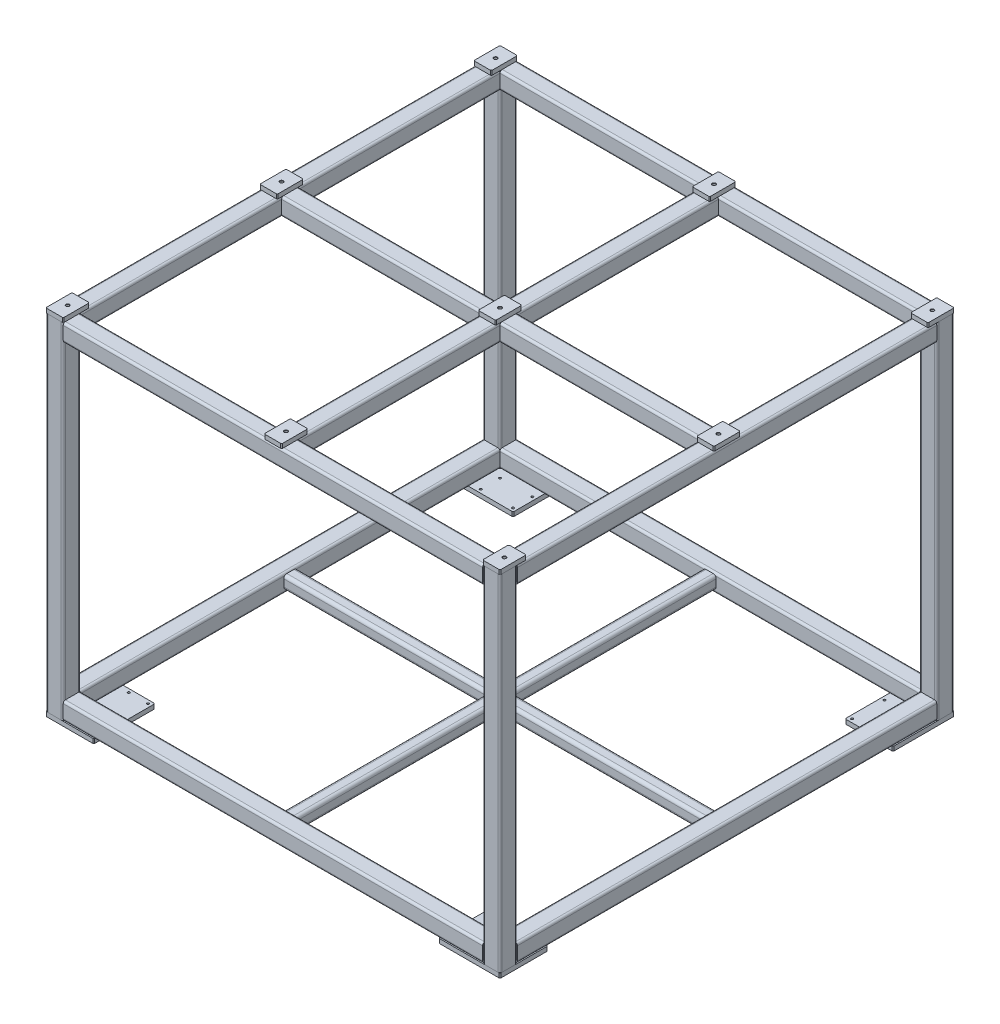
from build123d import *

# Parameters (mm, degrees)
F_40_START                  = -480
F_40_X_40_X_2_5_1_DEPTH     = 960
F_40_X_40_X_2_5_1_2_DEPTH   = 960
F_40_X_40_X_2_5_1_3_DEPTH   = 460
F_40_START_2                = 20
F_40_X_40_X_2_5_1_4_DEPTH   = 460
F_40_START_3                = -750
F_40_X_40_X_2_5_1_5_DEPTH   = 750
F_30_X_30_X_3_5_1_DEPTH     = 1000
F_30_X_30_X_3_5_1_2_DEPTH   = 501
F_30_X_30_X_3_5_1_3_DEPTH   = 501
WELD_START                  = -770
WELD_TRIM_1_DEPTH           = 790
SKETCH_4_W                  = 40
SKETCH_4_H                  = 60
EXTRUDE_1_DEPTH             = 10
CHAMFER_1_SIZE              = 2
PATTERN_LINEAR_1_COUNT      = 3
PATTERN_LINEAR_1_PITCH      = 500
PATTERN_LINEAR_1_2_COUNT    = 3
PATTERN_LINEAR_1_2_PITCH    = 490
SKETCH_7_W                  = 110
SKETCH_7_H                  = 140
EXTRUDE_2_DEPTH             = 10
CHAMFER_2_SIZE              = 2
HOLE_WIZARD_M6_2_AT_2_COUNT = 2
HOLE_WIZARD_M6_2_AT_2_PITCH = 44
HOLE_WIZARD_M6_2_AT_3_COUNT = 2
HOLE_WIZARD_M6_2_AT_3_PITCH = 74
HOLE_WIZARD_M6_2_AT_4_COUNT = 2
HOLE_WIZARD_M6_2_AT_4_PITCH = 86.092973
PATTERN_CIRCULAR_1_COUNT    = 4


# Read off the part's stored shape, not the designer's step: 方管 40 X 40 X 2.5(1), 剪裁/延伸1
with BuildPart() as part:
    # 方管 40 X 40 X 2.5(1) outline → 方管 40 X 40 X 2.5(1) (new body)
    # profile 1 of 5: a face of its own
    with BuildSketch(Plane.XY.offset(F_40_START)):
        with BuildLine():
            Line((520, -15), (520, 15))
            ThreePointArc((520, 15), (518.535533906, 18.535533906), (515, 20))
            Line((515, 20), (485, 20))
            ThreePointArc((485, 20), (481.464466094, 18.535533906), (480, 15))
            Line((480, 15), (480, -15))
            ThreePointArc((480, -15), (481.464466094, -18.535533906), (485, -20))
            Line((485, -20), (515, -20))
            ThreePointArc((515, -20), (518.535533906, -18.535533906), (520, -15))
        make_face()
        with BuildLine():
            ThreePointArc((485, -17.5), (483.232233047, -16.767766953), (482.5, -15))
            Line((482.5, -15), (482.5, 15))
            ThreePointArc((482.5, 15), (483.232233047, 16.767766953), (485, 17.5))
            Line((485, 17.5), (515, 17.5))
            ThreePointArc((515, 17.5), (516.767766953, 16.767766953), (517.5, 15))
            Line((517.5, 15), (517.5, -15))
            ThreePointArc((517.5, -15), (516.767766953, -16.767766953), (515, -17.5))
            Line((515, -17.5), (485, -17.5))
        make_face(mode=Mode.SUBTRACT)
    # profile 2 of 5: a face of its own
    with BuildSketch(Plane.XY.offset(F_40_START)):
        with BuildLine():
            Line((520, -765), (520, -735))
            ThreePointArc((520, -735), (518.535533906, -731.464466094), (515, -730))
            Line((515, -730), (485, -730))
            ThreePointArc((485, -730), (481.464466094, -731.464466094), (480, -735))
            Line((480, -735), (480, -765))
            ThreePointArc((480, -765), (481.464466094, -768.535533906), (485, -770))
            Line((485, -770), (515, -770))
            ThreePointArc((515, -770), (518.535533906, -768.535533906), (520, -765))
        make_face()
        with BuildLine():
            ThreePointArc((485, -767.5), (483.232233047, -766.767766953), (482.5, -765))
            Line((482.5, -765), (482.5, -735))
            ThreePointArc((482.5, -735), (483.232233047, -733.232233047), (485, -732.5))
            Line((485, -732.5), (515, -732.5))
            ThreePointArc((515, -732.5), (516.767766953, -733.232233047), (517.5, -735))
            Line((517.5, -735), (517.5, -765))
            ThreePointArc((517.5, -765), (516.767766953, -766.767766953), (515, -767.5))
            Line((515, -767.5), (485, -767.5))
        make_face(mode=Mode.SUBTRACT)
    # profile 3 of 5: a face of its own
    with BuildSketch(Plane.XY.offset(F_40_START)):
        with BuildLine():
            Line((-480, -15), (-480, 15))
            ThreePointArc((-480, 15), (-481.464466094, 18.535533906), (-485, 20))
            Line((-485, 20), (-515, 20))
            ThreePointArc((-515, 20), (-518.535533906, 18.535533906), (-520, 15))
            Line((-520, 15), (-520, -15))
            ThreePointArc((-520, -15), (-518.535533906, -18.535533906), (-515, -20))
            Line((-515, -20), (-485, -20))
            ThreePointArc((-485, -20), (-481.464466094, -18.535533906), (-480, -15))
        make_face()
        with BuildLine():
            ThreePointArc((-515, -17.5), (-516.767766953, -16.767766953), (-517.5, -15))
            Line((-517.5, -15), (-517.5, 15))
            ThreePointArc((-517.5, 15), (-516.767766953, 16.767766953), (-515, 17.5))
            Line((-515, 17.5), (-485, 17.5))
            ThreePointArc((-485, 17.5), (-483.232233047, 16.767766953), (-482.5, 15))
            Line((-482.5, 15), (-482.5, -15))
            ThreePointArc((-482.5, -15), (-483.232233047, -16.767766953), (-485, -17.5))
            Line((-485, -17.5), (-515, -17.5))
        make_face(mode=Mode.SUBTRACT)
    # profile 4 of 5: a face of its own
    with BuildSketch(Plane.XY.offset(F_40_START)):
        with BuildLine():
            Line((-480, -765), (-480, -735))
            ThreePointArc((-480, -735), (-481.464466094, -731.464466094), (-485, -730))
            Line((-485, -730), (-515, -730))
            ThreePointArc((-515, -730), (-518.535533906, -731.464466094), (-520, -735))
            Line((-520, -735), (-520, -765))
            ThreePointArc((-520, -765), (-518.535533906, -768.535533906), (-515, -770))
            Line((-515, -770), (-485, -770))
            ThreePointArc((-485, -770), (-481.464466094, -768.535533906), (-480, -765))
        make_face()
        with BuildLine():
            ThreePointArc((-515, -767.5), (-516.767766953, -766.767766953), (-517.5, -765))
            Line((-517.5, -765), (-517.5, -735))
            ThreePointArc((-517.5, -735), (-516.767766953, -733.232233047), (-515, -732.5))
            Line((-515, -732.5), (-485, -732.5))
            ThreePointArc((-485, -732.5), (-483.232233047, -733.232233047), (-482.5, -735))
            Line((-482.5, -735), (-482.5, -765))
            ThreePointArc((-482.5, -765), (-483.232233047, -766.767766953), (-485, -767.5))
            Line((-485, -767.5), (-515, -767.5))
        make_face(mode=Mode.SUBTRACT)
    # profile 5 of 5: a face of its own
    with BuildSketch(Plane.XY.offset(F_40_START)):
        with BuildLine():
            Line((20, -15), (20, 15))
            ThreePointArc((20, 15), (18.535533906, 18.535533906), (15, 20))
            Line((15, 20), (-15, 20))
            ThreePointArc((-15, 20), (-18.535533906, 18.535533906), (-20, 15))
            Line((-20, 15), (-20, -15))
            ThreePointArc((-20, -15), (-18.535533906, -18.535533906), (-15, -20))
            Line((-15, -20), (15, -20))
            ThreePointArc((15, -20), (18.535533906, -18.535533906), (20, -15))
        make_face()
        with BuildLine():
            ThreePointArc((-15, -17.5), (-16.767766953, -16.767766953), (-17.5, -15))
            Line((-17.5, -15), (-17.5, 15))
            ThreePointArc((-17.5, 15), (-16.767766953, 16.767766953), (-15, 17.5))
            Line((-15, 17.5), (15, 17.5))
            ThreePointArc((15, 17.5), (16.767766953, 16.767766953), (17.5, 15))
            Line((17.5, 15), (17.5, -15))
            ThreePointArc((17.5, -15), (16.767766953, -16.767766953), (15, -17.5))
            Line((15, -17.5), (-15, -17.5))
        make_face(mode=Mode.SUBTRACT)
    extrude(amount=F_40_X_40_X_2_5_1_DEPTH)


with BuildPart() as body_2:
    # 40 X 40 X 2.5_1 2 outline → 40 X 40 X 2.5_1 2 (new body)
    # profile 1 of 4: a face of its own
    with BuildSketch(Plane.YZ.offset(F_40_START)):
        with BuildLine():
            Line((-15, 480), (15, 480))
            ThreePointArc((15, 480), (18.535533906, 481.464466094), (20, 485))
            Line((20, 485), (20, 515))
            ThreePointArc((20, 515), (18.535533906, 518.535533906), (15, 520))
            Line((15, 520), (-15, 520))
            ThreePointArc((-15, 520), (-18.535533906, 518.535533906), (-20, 515))
            Line((-20, 515), (-20, 485))
            ThreePointArc((-20, 485), (-18.535533906, 481.464466094), (-15, 480))
        make_face()
        with BuildLine():
            ThreePointArc((-17.5, 515), (-16.767766953, 516.767766953), (-15, 517.5))
            Line((-15, 517.5), (15, 517.5))
            ThreePointArc((15, 517.5), (16.767766953, 516.767766953), (17.5, 515))
            Line((17.5, 515), (17.5, 485))
            ThreePointArc((17.5, 485), (16.767766953, 483.232233047), (15, 482.5))
            Line((15, 482.5), (-15, 482.5))
            ThreePointArc((-15, 482.5), (-16.767766953, 483.232233047), (-17.5, 485))
            Line((-17.5, 485), (-17.5, 515))
        make_face(mode=Mode.SUBTRACT)
    # profile 2 of 4: a face of its own
    with BuildSketch(Plane.YZ.offset(F_40_START)):
        with BuildLine():
            Line((-765, 480), (-735, 480))
            ThreePointArc((-735, 480), (-731.464466094, 481.464466094), (-730, 485))
            Line((-730, 485), (-730, 515))
            ThreePointArc((-730, 515), (-731.464466094, 518.535533906), (-735, 520))
            Line((-735, 520), (-765, 520))
            ThreePointArc((-765, 520), (-768.535533906, 518.535533906), (-770, 515))
            Line((-770, 515), (-770, 485))
            ThreePointArc((-770, 485), (-768.535533906, 481.464466094), (-765, 480))
        make_face()
        with BuildLine():
            ThreePointArc((-767.5, 515), (-766.767766953, 516.767766953), (-765, 517.5))
            Line((-765, 517.5), (-735, 517.5))
            ThreePointArc((-735, 517.5), (-733.232233047, 516.767766953), (-732.5, 515))
            Line((-732.5, 515), (-732.5, 485))
            ThreePointArc((-732.5, 485), (-733.232233047, 483.232233047), (-735, 482.5))
            Line((-735, 482.5), (-765, 482.5))
            ThreePointArc((-765, 482.5), (-766.767766953, 483.232233047), (-767.5, 485))
            Line((-767.5, 485), (-767.5, 515))
        make_face(mode=Mode.SUBTRACT)
    # profile 3 of 4: a face of its own
    with BuildSketch(Plane.YZ.offset(F_40_START)):
        with BuildLine():
            Line((-15, -520), (15, -520))
            ThreePointArc((15, -520), (18.535533906, -518.535533906), (20, -515))
            Line((20, -515), (20, -485))
            ThreePointArc((20, -485), (18.535533906, -481.464466094), (15, -480))
            Line((15, -480), (-15, -480))
            ThreePointArc((-15, -480), (-18.535533906, -481.464466094), (-20, -485))
            Line((-20, -485), (-20, -515))
            ThreePointArc((-20, -515), (-18.535533906, -518.535533906), (-15, -520))
        make_face()
        with BuildLine():
            ThreePointArc((-17.5, -485), (-16.767766953, -483.232233047), (-15, -482.5))
            Line((-15, -482.5), (15, -482.5))
            ThreePointArc((15, -482.5), (16.767766953, -483.232233047), (17.5, -485))
            Line((17.5, -485), (17.5, -515))
            ThreePointArc((17.5, -515), (16.767766953, -516.767766953), (15, -517.5))
            Line((15, -517.5), (-15, -517.5))
            ThreePointArc((-15, -517.5), (-16.767766953, -516.767766953), (-17.5, -515))
            Line((-17.5, -515), (-17.5, -485))
        make_face(mode=Mode.SUBTRACT)
    # profile 4 of 4: a face of its own
    with BuildSketch(Plane.YZ.offset(F_40_START)):
        with BuildLine():
            Line((-765, -520), (-735, -520))
            ThreePointArc((-735, -520), (-731.464466094, -518.535533906), (-730, -515))
            Line((-730, -515), (-730, -485))
            ThreePointArc((-730, -485), (-731.464466094, -481.464466094), (-735, -480))
            Line((-735, -480), (-765, -480))
            ThreePointArc((-765, -480), (-768.535533906, -481.464466094), (-770, -485))
            Line((-770, -485), (-770, -515))
            ThreePointArc((-770, -515), (-768.535533906, -518.535533906), (-765, -520))
        make_face()
        with BuildLine():
            ThreePointArc((-767.5, -485), (-766.767766953, -483.232233047), (-765, -482.5))
            Line((-765, -482.5), (-735, -482.5))
            ThreePointArc((-735, -482.5), (-733.232233047, -483.232233047), (-732.5, -485))
            Line((-732.5, -485), (-732.5, -515))
            ThreePointArc((-732.5, -515), (-733.232233047, -516.767766953), (-735, -517.5))
            Line((-735, -517.5), (-765, -517.5))
            ThreePointArc((-765, -517.5), (-766.767766953, -516.767766953), (-767.5, -515))
            Line((-767.5, -515), (-767.5, -485))
        make_face(mode=Mode.SUBTRACT)
    extrude(amount=F_40_X_40_X_2_5_1_2_DEPTH)


with BuildPart() as body_3:
    # 40 X 40 X 2.5_1 3 outline → 40 X 40 X 2.5_1 3 (new body)
    with BuildSketch(Plane.YZ.offset(F_40_START)):
        with BuildLine():
            Line((15, 20), (-15, 20))
            ThreePointArc((-15, 20), (-18.535533906, 18.535533906), (-20, 15))
            Line((-20, 15), (-20, -15))
            ThreePointArc((-20, -15), (-18.535533906, -18.535533906), (-15, -20))
            Line((-15, -20), (15, -20))
            ThreePointArc((15, -20), (18.535533906, -18.535533906), (20, -15))
            Line((20, -15), (20, 15))
            ThreePointArc((20, 15), (18.535533906, 18.535533906), (15, 20))
        make_face()
        with BuildLine():
            ThreePointArc((17.5, -15), (16.767766953, -16.767766953), (15, -17.5))
            Line((15, -17.5), (-15, -17.5))
            ThreePointArc((-15, -17.5), (-16.767766953, -16.767766953), (-17.5, -15))
            Line((-17.5, -15), (-17.5, 15))
            ThreePointArc((-17.5, 15), (-16.767766953, 16.767766953), (-15, 17.5))
            Line((-15, 17.5), (15, 17.5))
            ThreePointArc((15, 17.5), (16.767766953, 16.767766953), (17.5, 15))
            Line((17.5, 15), (17.5, -15))
        make_face(mode=Mode.SUBTRACT)
    extrude(amount=F_40_X_40_X_2_5_1_3_DEPTH)


with BuildPart() as body_4:
    # 40 X 40 X 2.5_1 4 outline → 40 X 40 X 2.5_1 4 (new body)
    with BuildSketch(Plane.YZ.offset(F_40_START_2)):
        with BuildLine():
            Line((15, 20), (-15, 20))
            ThreePointArc((-15, 20), (-18.535533906, 18.535533906), (-20, 15))
            Line((-20, 15), (-20, -15))
            ThreePointArc((-20, -15), (-18.535533906, -18.535533906), (-15, -20))
            Line((-15, -20), (15, -20))
            ThreePointArc((15, -20), (18.535533906, -18.535533906), (20, -15))
            Line((20, -15), (20, 15))
            ThreePointArc((20, 15), (18.535533906, 18.535533906), (15, 20))
        make_face()
        with BuildLine():
            ThreePointArc((17.5, -15), (16.767766953, -16.767766953), (15, -17.5))
            Line((15, -17.5), (-15, -17.5))
            ThreePointArc((-15, -17.5), (-16.767766953, -16.767766953), (-17.5, -15))
            Line((-17.5, -15), (-17.5, 15))
            ThreePointArc((-17.5, 15), (-16.767766953, 16.767766953), (-15, 17.5))
            Line((-15, 17.5), (15, 17.5))
            ThreePointArc((15, 17.5), (16.767766953, 16.767766953), (17.5, 15))
            Line((17.5, 15), (17.5, -15))
        make_face(mode=Mode.SUBTRACT)
    extrude(amount=F_40_X_40_X_2_5_1_4_DEPTH)


with BuildPart() as body_5:
    # 40 X 40 X 2.5_1 5 outline → 40 X 40 X 2.5_1 5 (new body)
    # profile 1 of 4: a face of its own
    with BuildSketch(Plane(origin=(0, 0, 0), x_dir=(1, 0, 0), z_dir=(0, 1, 0)).offset(F_40_START_3)):
        with BuildLine():
            Line((-515, -520), (-485, -520))
            ThreePointArc((-485, -520), (-481.464466094, -518.535533906), (-480, -515))
            Line((-480, -515), (-480, -485))
            ThreePointArc((-480, -485), (-481.464466094, -481.464466094), (-485, -480))
            Line((-485, -480), (-515, -480))
            ThreePointArc((-515, -480), (-518.535533906, -481.464466094), (-520, -485))
            Line((-520, -485), (-520, -515))
            ThreePointArc((-520, -515), (-518.535533906, -518.535533906), (-515, -520))
        make_face()
        with BuildLine():
            ThreePointArc((-515, -517.5), (-516.767766953, -516.767766953), (-517.5, -515))
            Line((-517.5, -515), (-517.5, -485))
            ThreePointArc((-517.5, -485), (-516.767766953, -483.232233047), (-515, -482.5))
            Line((-515, -482.5), (-485, -482.5))
            ThreePointArc((-485, -482.5), (-483.232233047, -483.232233047), (-482.5, -485))
            Line((-482.5, -485), (-482.5, -515))
            ThreePointArc((-482.5, -515), (-483.232233047, -516.767766953), (-485, -517.5))
            Line((-485, -517.5), (-515, -517.5))
        make_face(mode=Mode.SUBTRACT)
    # profile 2 of 4: a face of its own
    with BuildSketch(Plane(origin=(0, 0, 0), x_dir=(1, 0, 0), z_dir=(0, 1, 0)).offset(F_40_START_3)):
        with BuildLine():
            Line((-515, 480), (-485, 480))
            ThreePointArc((-485, 480), (-481.464466094, 481.464466094), (-480, 485))
            Line((-480, 485), (-480, 515))
            ThreePointArc((-480, 515), (-481.464466094, 518.535533906), (-485, 520))
            Line((-485, 520), (-515, 520))
            ThreePointArc((-515, 520), (-518.535533906, 518.535533906), (-520, 515))
            Line((-520, 515), (-520, 485))
            ThreePointArc((-520, 485), (-518.535533906, 481.464466094), (-515, 480))
        make_face()
        with BuildLine():
            ThreePointArc((-515, 482.5), (-516.767766953, 483.232233047), (-517.5, 485))
            Line((-517.5, 485), (-517.5, 515))
            ThreePointArc((-517.5, 515), (-516.767766953, 516.767766953), (-515, 517.5))
            Line((-515, 517.5), (-485, 517.5))
            ThreePointArc((-485, 517.5), (-483.232233047, 516.767766953), (-482.5, 515))
            Line((-482.5, 515), (-482.5, 485))
            ThreePointArc((-482.5, 485), (-483.232233047, 483.232233047), (-485, 482.5))
            Line((-485, 482.5), (-515, 482.5))
        make_face(mode=Mode.SUBTRACT)
    # profile 3 of 4: a face of its own
    with BuildSketch(Plane(origin=(0, 0, 0), x_dir=(1, 0, 0), z_dir=(0, 1, 0)).offset(F_40_START_3)):
        with BuildLine():
            Line((485, 480), (515, 480))
            ThreePointArc((515, 480), (518.535533906, 481.464466094), (520, 485))
            Line((520, 485), (520, 515))
            ThreePointArc((520, 515), (518.535533906, 518.535533906), (515, 520))
            Line((515, 520), (485, 520))
            ThreePointArc((485, 520), (481.464466094, 518.535533906), (480, 515))
            Line((480, 515), (480, 485))
            ThreePointArc((480, 485), (481.464466094, 481.464466094), (485, 480))
        make_face()
        with BuildLine():
            ThreePointArc((485, 482.5), (483.232233047, 483.232233047), (482.5, 485))
            Line((482.5, 485), (482.5, 515))
            ThreePointArc((482.5, 515), (483.232233047, 516.767766953), (485, 517.5))
            Line((485, 517.5), (515, 517.5))
            ThreePointArc((515, 517.5), (516.767766953, 516.767766953), (517.5, 515))
            Line((517.5, 515), (517.5, 485))
            ThreePointArc((517.5, 485), (516.767766953, 483.232233047), (515, 482.5))
            Line((515, 482.5), (485, 482.5))
        make_face(mode=Mode.SUBTRACT)
    # profile 4 of 4: a face of its own
    with BuildSketch(Plane(origin=(0, 0, 0), x_dir=(1, 0, 0), z_dir=(0, 1, 0)).offset(F_40_START_3)):
        with BuildLine():
            Line((485, -520), (515, -520))
            ThreePointArc((515, -520), (518.535533906, -518.535533906), (520, -515))
            Line((520, -515), (520, -485))
            ThreePointArc((520, -485), (518.535533906, -481.464466094), (515, -480))
            Line((515, -480), (485, -480))
            ThreePointArc((485, -480), (481.464466094, -481.464466094), (480, -485))
            Line((480, -485), (480, -515))
            ThreePointArc((480, -515), (481.464466094, -518.535533906), (485, -520))
        make_face()
        with BuildLine():
            ThreePointArc((485, -517.5), (483.232233047, -516.767766953), (482.5, -515))
            Line((482.5, -515), (482.5, -485))
            ThreePointArc((482.5, -485), (483.232233047, -483.232233047), (485, -482.5))
            Line((485, -482.5), (515, -482.5))
            ThreePointArc((515, -482.5), (516.767766953, -483.232233047), (517.5, -485))
            Line((517.5, -485), (517.5, -515))
            ThreePointArc((517.5, -515), (516.767766953, -516.767766953), (515, -517.5))
            Line((515, -517.5), (485, -517.5))
        make_face(mode=Mode.SUBTRACT)
    extrude(amount=F_40_X_40_X_2_5_1_5_DEPTH)

    # Weld Trim 1 outline → Weld Trim 1 (add)
    # profile 1 of 4: a face of its own
    with BuildSketch(Plane(origin=(0, 0, 0), x_dir=(1, 0, 0), z_dir=(0, 1, 0)).offset(WELD_START)):
        with BuildLine():
            Line((-515, -520), (-485, -520))
            ThreePointArc((-485, -520), (-481.464466094, -518.535533906), (-480, -515))
            Line((-480, -515), (-480, -485))
            ThreePointArc((-480, -485), (-481.464466094, -481.464466094), (-485, -480))
            Line((-485, -480), (-515, -480))
            ThreePointArc((-515, -480), (-518.535533906, -481.464466094), (-520, -485))
            Line((-520, -485), (-520, -515))
            ThreePointArc((-520, -515), (-518.535533906, -518.535533906), (-515, -520))
        make_face()
        with BuildLine():
            ThreePointArc((-515, -517.5), (-516.767766953, -516.767766953), (-517.5, -515))
            Line((-517.5, -515), (-517.5, -485))
            ThreePointArc((-517.5, -485), (-516.767766953, -483.232233047), (-515, -482.5))
            Line((-515, -482.5), (-485, -482.5))
            ThreePointArc((-485, -482.5), (-483.232233047, -483.232233047), (-482.5, -485))
            Line((-482.5, -485), (-482.5, -515))
            ThreePointArc((-482.5, -515), (-483.232233047, -516.767766953), (-485, -517.5))
            Line((-485, -517.5), (-515, -517.5))
        make_face(mode=Mode.SUBTRACT)
    # profile 2 of 4: a face of its own
    with BuildSketch(Plane(origin=(0, 0, 0), x_dir=(1, 0, 0), z_dir=(0, 1, 0)).offset(WELD_START)):
        with BuildLine():
            Line((485, -520), (515, -520))
            ThreePointArc((515, -520), (518.535533906, -518.535533906), (520, -515))
            Line((520, -515), (520, -485))
            ThreePointArc((520, -485), (518.535533906, -481.464466094), (515, -480))
            Line((515, -480), (485, -480))
            ThreePointArc((485, -480), (481.464466094, -481.464466094), (480, -485))
            Line((480, -485), (480, -515))
            ThreePointArc((480, -515), (481.464466094, -518.535533906), (485, -520))
        make_face()
        with BuildLine():
            ThreePointArc((517.5, -515), (516.767766953, -516.767766953), (515, -517.5))
            Line((515, -517.5), (485, -517.5))
            ThreePointArc((485, -517.5), (483.232233047, -516.767766953), (482.5, -515))
            Line((482.5, -515), (482.5, -485))
            ThreePointArc((482.5, -485), (483.232233047, -483.232233047), (485, -482.5))
            Line((485, -482.5), (515, -482.5))
            ThreePointArc((515, -482.5), (516.767766953, -483.232233047), (517.5, -485))
            Line((517.5, -485), (517.5, -515))
        make_face(mode=Mode.SUBTRACT)
    # profile 3 of 4: a face of its own
    with BuildSketch(Plane(origin=(0, 0, 0), x_dir=(1, 0, 0), z_dir=(0, 1, 0)).offset(WELD_START)):
        with BuildLine():
            Line((-520, 515), (-520, 485))
            ThreePointArc((-520, 485), (-518.535533906, 481.464466094), (-515, 480))
            Line((-515, 480), (-485, 480))
            ThreePointArc((-485, 480), (-481.464466094, 481.464466094), (-480, 485))
            Line((-480, 485), (-480, 515))
            ThreePointArc((-480, 515), (-481.464466094, 518.535533906), (-485, 520))
            Line((-485, 520), (-515, 520))
            ThreePointArc((-515, 520), (-518.535533906, 518.535533906), (-520, 515))
        make_face()
        with BuildLine():
            ThreePointArc((-485, 517.5), (-483.232233047, 516.767766953), (-482.5, 515))
            Line((-482.5, 515), (-482.5, 485))
            ThreePointArc((-482.5, 485), (-483.232233047, 483.232233047), (-485, 482.5))
            Line((-485, 482.5), (-515, 482.5))
            ThreePointArc((-515, 482.5), (-516.767766953, 483.232233047), (-517.5, 485))
            Line((-517.5, 485), (-517.5, 515))
            ThreePointArc((-517.5, 515), (-516.767766953, 516.767766953), (-515, 517.5))
            Line((-515, 517.5), (-485, 517.5))
        make_face(mode=Mode.SUBTRACT)
    # profile 4 of 4: a face of its own
    with BuildSketch(Plane(origin=(0, 0, 0), x_dir=(1, 0, 0), z_dir=(0, 1, 0)).offset(WELD_START)):
        with BuildLine():
            Line((485, 480), (515, 480))
            ThreePointArc((515, 480), (518.535533906, 481.464466094), (520, 485))
            Line((520, 485), (520, 515))
            ThreePointArc((520, 515), (518.535533906, 518.535533906), (515, 520))
            Line((515, 520), (485, 520))
            ThreePointArc((485, 520), (481.464466094, 518.535533906), (480, 515))
            Line((480, 515), (480, 485))
            ThreePointArc((480, 485), (481.464466094, 481.464466094), (485, 480))
        make_face()
        with BuildLine():
            ThreePointArc((517.5, 485), (516.767766953, 483.232233047), (515, 482.5))
            Line((515, 482.5), (485, 482.5))
            ThreePointArc((485, 482.5), (483.232233047, 483.232233047), (482.5, 485))
            Line((482.5, 485), (482.5, 515))
            ThreePointArc((482.5, 515), (483.232233047, 516.767766953), (485, 517.5))
            Line((485, 517.5), (515, 517.5))
            ThreePointArc((515, 517.5), (516.767766953, 516.767766953), (517.5, 515))
            Line((517.5, 515), (517.5, 485))
        make_face(mode=Mode.SUBTRACT)
    extrude(amount=WELD_TRIM_1_DEPTH)


with BuildPart() as body_6:
    # Sketch11 → 方管 30 X 30 X 3.5(1) (new body)
    with BuildSketch(Plane(origin=(0, -750, -500), x_dir=(1, 0, 0), z_dir=(0, 0, 1))):
        with BuildLine():
            Line((-8, -15), (8, -15))
            ThreePointArc((8, -15), (12.949747468, -12.949747468), (15, -8))
            Line((15, -8), (15, 8))
            ThreePointArc((15, 8), (12.949747468, 12.949747468), (8, 15))
            Line((8, 15), (-8, 15))
            ThreePointArc((-8, 15), (-12.949747468, 12.949747468), (-15, 8))
            Line((-15, 8), (-15, -8))
            ThreePointArc((-15, -8), (-12.949747468, -12.949747468), (-8, -15))
        make_face()
        with BuildLine():
            Line((-8, -11.5), (8, -11.5))
            ThreePointArc((8, -11.5), (10.474873734, -10.474873734), (11.5, -8))
            Line((11.5, -8), (11.5, 8))
            ThreePointArc((11.5, 8), (10.474873734, 10.474873734), (8, 11.5))
            Line((8, 11.5), (-8, 11.5))
            ThreePointArc((-8, 11.5), (-10.474873734, 10.474873734), (-11.5, 8))
            Line((-11.5, 8), (-11.5, -8))
            ThreePointArc((-11.5, -8), (-10.474873734, -10.474873734), (-8, -11.5))
        make_face(mode=Mode.SUBTRACT)
    extrude(amount=F_30_X_30_X_3_5_1_DEPTH)

    # Weld Trim 2 3
    split(bisect_by=Plane(origin=(0, -750, -480), x_dir=(0, -1, 0), z_dir=(0, 0, 1)), keep=Keep.TOP)

    # Weld Trim 2 7
    split(bisect_by=Plane(origin=(0, -750, 480), x_dir=(0, 1, 0), z_dir=(0, 0, -1)), keep=Keep.TOP)


with BuildPart() as body_7:
    # Sketch11 on segment 2 (carried to segment 2) → 30 X 30 X 3.5_1 2 (new body)
    with BuildSketch(Plane(origin=(-1, -750, 0), x_dir=(0, 0, -1), z_dir=(1, 0, 0))):
        with BuildLine():
            Line((-8, -15), (8, -15))
            ThreePointArc((8, -15), (12.949747468, -12.949747468), (15, -8))
            Line((15, -8), (15, 8))
            ThreePointArc((15, 8), (12.949747468, 12.949747468), (8, 15))
            Line((8, 15), (-8, 15))
            ThreePointArc((-8, 15), (-12.949747468, 12.949747468), (-15, 8))
            Line((-15, 8), (-15, -8))
            ThreePointArc((-15, -8), (-12.949747468, -12.949747468), (-8, -15))
        make_face()
        with BuildLine():
            Line((-8, -11.5), (8, -11.5))
            ThreePointArc((8, -11.5), (10.474873734, -10.474873734), (11.5, -8))
            Line((11.5, -8), (11.5, 8))
            ThreePointArc((11.5, 8), (10.474873734, 10.474873734), (8, 11.5))
            Line((8, 11.5), (-8, 11.5))
            ThreePointArc((-8, 11.5), (-10.474873734, 10.474873734), (-11.5, 8))
            Line((-11.5, 8), (-11.5, -8))
            ThreePointArc((-11.5, -8), (-10.474873734, -10.474873734), (-8, -11.5))
        make_face(mode=Mode.SUBTRACT)
    extrude(amount=F_30_X_30_X_3_5_1_2_DEPTH)

    # 30 X 30 X 3.5_1 2 end butt 1
    split(bisect_by=Plane(origin=(15, -750, 0), x_dir=(0, 1, 0), z_dir=(1, 0, 0)), keep=Keep.TOP)

    # Weld Trim 2 5
    split(bisect_by=Plane(origin=(480, -750, 0), x_dir=(0, -1, 0), z_dir=(-1, 0, 0)), keep=Keep.TOP)


with BuildPart() as body_8:
    # Sketch11 on segment 3 (carried to segment 3) → 30 X 30 X 3.5_1 3 (new body)
    with BuildSketch(Plane(origin=(1, -750, 0), x_dir=(0, 0, 1), z_dir=(-1, 0, 0))):
        with BuildLine():
            Line((-8, -15), (8, -15))
            ThreePointArc((8, -15), (12.949747468, -12.949747468), (15, -8))
            Line((15, -8), (15, 8))
            ThreePointArc((15, 8), (12.949747468, 12.949747468), (8, 15))
            Line((8, 15), (-8, 15))
            ThreePointArc((-8, 15), (-12.949747468, 12.949747468), (-15, 8))
            Line((-15, 8), (-15, -8))
            ThreePointArc((-15, -8), (-12.949747468, -12.949747468), (-8, -15))
        make_face()
        with BuildLine():
            Line((-8, -11.5), (8, -11.5))
            ThreePointArc((8, -11.5), (10.474873734, -10.474873734), (11.5, -8))
            Line((11.5, -8), (11.5, 8))
            ThreePointArc((11.5, 8), (10.474873734, 10.474873734), (8, 11.5))
            Line((8, 11.5), (-8, 11.5))
            ThreePointArc((-8, 11.5), (-10.474873734, 10.474873734), (-11.5, 8))
            Line((-11.5, 8), (-11.5, -8))
            ThreePointArc((-11.5, -8), (-10.474873734, -10.474873734), (-8, -11.5))
        make_face(mode=Mode.SUBTRACT)
    extrude(amount=F_30_X_30_X_3_5_1_3_DEPTH)

    # 30 X 30 X 3.5_1 3 end butt 1
    split(bisect_by=Plane(origin=(-15, -750, 0), x_dir=(0, -1, 0), z_dir=(-1, 0, 0)), keep=Keep.TOP)

    # Weld Trim 2
    split(bisect_by=Plane(origin=(-480, -750, 0), x_dir=(0, 1, 0), z_dir=(1, 0, 0)), keep=Keep.TOP)


with BuildPart() as body_7_1:
    # Move Body 1: moved
    add(body_7.part.moved(Location((0, 2, 0))))


with BuildPart() as body_8_1:
    # Move Body 1: moved
    add(body_8.part.moved(Location((0, 2, 0))))


with BuildPart() as body_6_1:
    # Move Body 1: moved
    add(body_6.part.moved(Location((0, 2, 0))))


with BuildPart() as body_9:
    # 草图4 → 凸台-拉伸1 (new body)
    with BuildSketch(Plane(origin=(0, 20, 0), x_dir=(1, 0, 0), z_dir=(0, 1, 0))):
        with Locations((-500, 490)):
            Rectangle(SKETCH_4_W, SKETCH_4_H)
    extrude(amount=EXTRUDE_1_DEPTH)

    # 倒角1
    chamfer_1_edges = [body_9.edges().sort_by_distance(p)[0] for p in [
        (-480, 25, -460),
        (-520, 25, -460),
        (-520, 25, -520),
        (-480, 25, -520),
    ]]
    chamfer(chamfer_1_edges, length=CHAMFER_1_SIZE)

    # 草图6 → M8 螺纹孔1 (revolve, cut)
    with BuildSketch(Plane(origin=(-500, 30, -490), x_dir=(0, 0, 1), z_dir=(1, 0, 0))):
        Polygon((0, 0), (0, 800), (3.4, 800), (3.4, 0.625), (4.025, 0), align=None)
    revolve(axis=Axis((-500, 36.35, -490), (0, -1, 0)), mode=Mode.SUBTRACT)


with BuildPart() as pattern_linear_1_1:
    # 阵列(线性)1: pattern copy
    add(body_9.part.moved(Location(Vector(1, 0, 0) * (1 * PATTERN_LINEAR_1_PITCH))))


with BuildPart() as pattern_linear_1_2:
    # 阵列(线性)1: pattern copy
    add(body_9.part.moved(Location(Vector(1, 0, 0) * (2 * PATTERN_LINEAR_1_PITCH))))


with BuildPart() as pattern_linear_1_2_1:
    # Pattern Linear 1 2: pattern copy
    add(body_9.part.moved(Location(Vector(0, 0, 1) * (1 * PATTERN_LINEAR_1_2_PITCH))))


with BuildPart() as pattern_linear_1_2_2:
    # Pattern Linear 1 2: pattern copy
    add(body_9.part.moved(Location(Vector(0, 0, 1) * (2 * PATTERN_LINEAR_1_2_PITCH))))


with BuildPart() as pattern_linear_1_2_3:
    # Pattern Linear 1 2: pattern copy
    add(pattern_linear_1_1.part.moved(Location(Vector(0, 0, 1) * (1 * PATTERN_LINEAR_1_2_PITCH))))


with BuildPart() as pattern_linear_1_2_4:
    # Pattern Linear 1 2: pattern copy
    add(pattern_linear_1_1.part.moved(Location(Vector(0, 0, 1) * (2 * PATTERN_LINEAR_1_2_PITCH))))


with BuildPart() as pattern_linear_1_2_5:
    # Pattern Linear 1 2: pattern copy
    add(pattern_linear_1_2.part.moved(Location(Vector(0, 0, 1) * (1 * PATTERN_LINEAR_1_2_PITCH))))


with BuildPart() as pattern_linear_1_2_6:
    # Pattern Linear 1 2: pattern copy
    add(pattern_linear_1_2.part.moved(Location(Vector(0, 0, 1) * (2 * PATTERN_LINEAR_1_2_PITCH))))


with BuildPart() as body_18:
    # 草图7 → 凸台-拉伸2 (new body)
    with BuildSketch(Plane.XZ.offset(770)):
        with Locations((-465, 450)):
            Rectangle(SKETCH_7_W, SKETCH_7_H)
    extrude(amount=EXTRUDE_2_DEPTH)

    # 倒角2
    chamfer_2_edges = [body_18.edges().sort_by_distance(p)[0] for p in [
        (-410, -775, 380),
        (-520, -775, 380),
        (-520, -775, 520),
        (-410, -775, 520),
    ]]
    chamfer(chamfer_2_edges, length=CHAMFER_2_SIZE)

    # 草图13 → M6 螺纹孔2 (revolve, cut)
    with BuildSketch(Plane(origin=(-462, -780, 388), x_dir=(0, 0, -1), z_dir=(1, 0, 0))):
        Polygon((0, 0), (0, 810), (2.5, 810), (2.5, 0.525), (3.025, 0), align=None)
    hole_wizard_m6_2 = revolve(axis=Axis((-462, -786.35, 388), (0, 1, 0)), mode=Mode.SUBTRACT)

    # M6 螺纹孔2 at 2: M6 螺纹孔2 ×2
    with Locations(*[(i * HOLE_WIZARD_M6_2_AT_2_PITCH, 0, 0) for i in range(1, HOLE_WIZARD_M6_2_AT_2_COUNT)]):
        add(hole_wizard_m6_2, mode=Mode.SUBTRACT)

    # M6 螺纹孔2 at 3: M6 螺纹孔2 ×2
    with Locations(*[(0, 0, i * HOLE_WIZARD_M6_2_AT_3_PITCH) for i in range(1, HOLE_WIZARD_M6_2_AT_3_COUNT)]):
        add(hole_wizard_m6_2, mode=Mode.SUBTRACT)

    # M6 螺纹孔2 at 4: M6 螺纹孔2 ×2
    with Locations(*[Vector(0.51107539287715, 0, 0.8595358880206613) * (i * HOLE_WIZARD_M6_2_AT_4_PITCH) for i in range(1, HOLE_WIZARD_M6_2_AT_4_COUNT)]):
        add(hole_wizard_m6_2, mode=Mode.SUBTRACT)


with BuildPart() as pattern_circular_1_1:
    # 阵列(圆周)1: pattern copy
    add(body_18.part.rotate(Axis((0, 0, 0), (0, 1, 0)), 1 * 360 / PATTERN_CIRCULAR_1_COUNT))


with BuildPart() as pattern_circular_1_2:
    # 阵列(圆周)1: pattern copy
    add(body_18.part.rotate(Axis((0, 0, 0), (0, 1, 0)), 2 * 360 / PATTERN_CIRCULAR_1_COUNT))


with BuildPart() as pattern_circular_1_3:
    # 阵列(圆周)1: pattern copy
    add(body_18.part.rotate(Axis((0, 0, 0), (0, 1, 0)), 3 * 360 / PATTERN_CIRCULAR_1_COUNT))


solid = Compound([part.part, body_2.part, body_3.part, body_4.part, body_5.part, body_7_1.part, body_8_1.part, body_6_1.part, body_9.part, pattern_linear_1_1.part, pattern_linear_1_2.part, pattern_linear_1_2_1.part, pattern_linear_1_2_2.part, pattern_linear_1_2_3.part, pattern_linear_1_2_4.part, pattern_linear_1_2_5.part, pattern_linear_1_2_6.part, body_18.part, pattern_circular_1_1.part, pattern_circular_1_2.part, pattern_circular_1_3.part])
